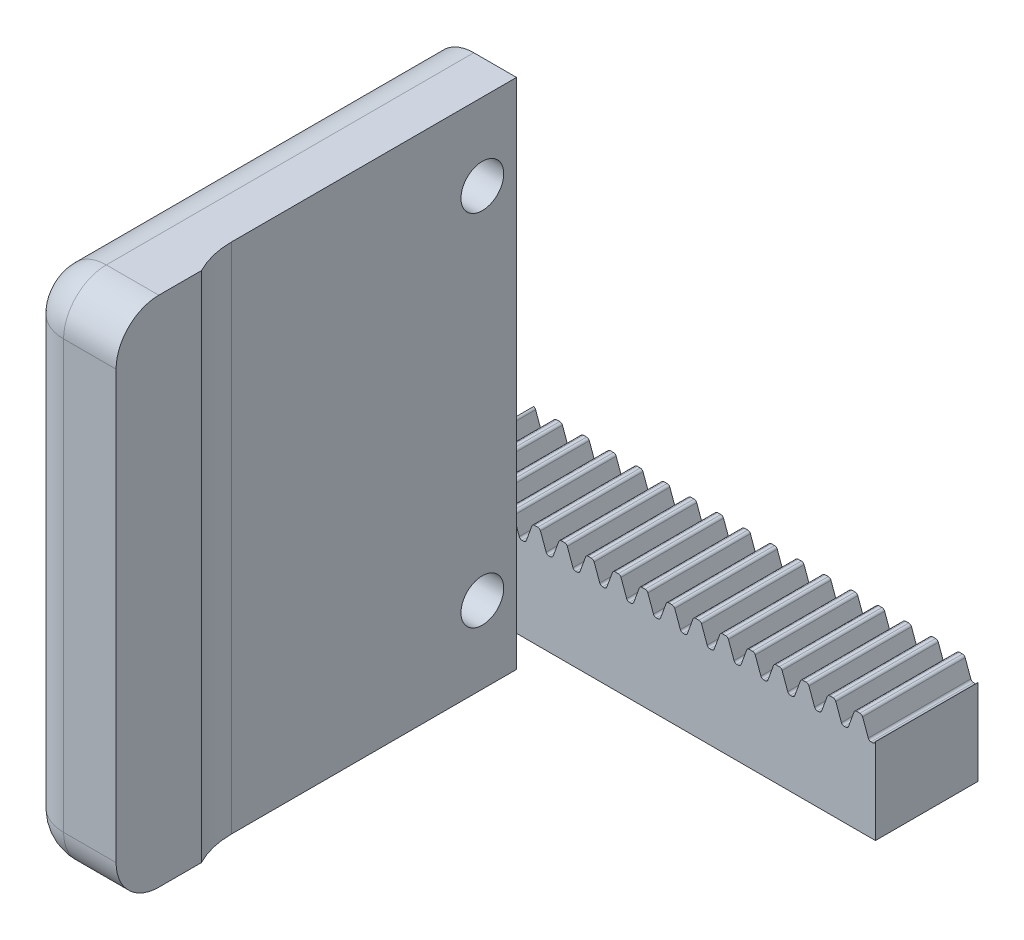
from build123d import *

# Parameters (mm, degrees)
BOSS_EXTRUDE1_DEPTH      = 6
BOSS_EXTRUDE1_DEPTH_BACK = 6
SKETCH3_W                = 100
SKETCH3_H                = 12
CUT_EXTRUDE1_DEPTH       = 51.714889332
LPATTERN1_COUNT          = 32
LPATTERN1_PITCH          = 3.141592654
LPATTERN1_COL_COUNT      = 2
LPATTERN1_COL_PITCH      = 3.141592654
SKETCH5_W                = 48.378939127
SKETCH5_H                = 12.380230967
CUT_EXTRUDE2_DEPTH       = 52.768716422
SKETCH6_W                = 10
SKETCH6_H                = 60
BOSS_EXTRUDE2_DEPTH      = 8
SKETCH8_R                = 2.5
CUT_EXTRUDE3_DEPTH       = 74.716454066
SKETCH9_W                = 11.14
SKETCH9_H                = 60
BOSS_EXTRUDE3_DEPTH      = 40
CUT_EXTRUDE4_DEPTH       = 95.952619764
CUT_EXTRUDE4_DEPTH_BACK  = 95.952619764
SKETCH10_W               = 1.14
SKETCH10_H               = 30
FILLET2_R                = 5
FILLET3_R                = 10


with BuildPart() as part:
    # Sketch3 → Boss-Extrude1 (new, two sides: drawn at the far end of the back side and taken through both)
    with BuildSketch(Plane.XY.offset(-BOSS_EXTRUDE1_DEPTH_BACK)):
        Rectangle(SKETCH3_W, SKETCH3_H)
    extrude(amount=BOSS_EXTRUDE1_DEPTH + BOSS_EXTRUDE1_DEPTH_BACK)

    # Sketch4 → Cut-Extrude1 (cut, symmetric)
    with BuildSketch(Plane.XY):
        with BuildLine():
            Line((-47.625666184, 5.779244445), (-47.545317733, 6))
            Line((-47.545317733, 6), (-48.694686131, 6))
            Line((-48.694686131, 6), (-48.694686131, 3.75))
            Line((-48.694686131, 3.75), (-48.599173915, 3.75))
            ThreePointArc((-48.599173915, 3.75), (-48.406736132, 3.8106754), (-48.283902309, 3.970755555))
            Line((-48.283902309, 3.970755555), (-47.625666184, 5.779244445))
        make_face()
        with BuildLine():
            Line((-47.310394578, 6), (-47.545317733, 6))
            Line((-47.545317733, 6), (-47.625666184, 5.779244445))
            ThreePointArc((-47.625666184, 5.779244445), (-47.502832361, 5.9393246), (-47.310394578, 6))
        make_face()
        with BuildLine():
            Line((-46.622113424, 5.779244445), (-46.702461875, 6))
            Line((-46.702461875, 6), (-46.93738503, 6))
            ThreePointArc((-46.93738503, 6), (-46.744947247, 5.9393246), (-46.622113424, 5.779244445))
        make_face()
        with BuildLine():
            Line((-45.553093477, 3.75), (-45.553093477, 6))
            Line((-45.553093477, 6), (-46.702461875, 6))
            Line((-46.702461875, 6), (-46.622113424, 5.779244445))
            Line((-46.622113424, 5.779244445), (-45.963877299, 3.970755555))
            ThreePointArc((-45.963877299, 3.970755555), (-45.841043475, 3.8106754), (-45.648605692, 3.75))
            Line((-45.648605692, 3.75), (-45.553093477, 3.75))
        make_face()
    cut_extrude1 = extrude(amount=CUT_EXTRUDE1_DEPTH, both=True, mode=Mode.SUBTRACT)

    # LPattern1: Cut-Extrude1 ×32
    with Locations(*[(i * LPATTERN1_PITCH, 0, 0) for i in range(1, LPATTERN1_COUNT)]):
        add(cut_extrude1, mode=Mode.SUBTRACT)

    # LPattern1 col: Cut-Extrude1 ×2
    with Locations(*[(-i * LPATTERN1_COL_PITCH, 0, 0) for i in range(1, LPATTERN1_COL_COUNT)]):
        add(cut_extrude1, mode=Mode.SUBTRACT)

    # Sketch5 → Cut-Extrude2 (cut, through all)
    with BuildSketch(Plane.XY.offset(6)):
        with Locations((26.189469564, 0.190115484)):
            Rectangle(SKETCH5_W, SKETCH5_H)
    extrude(amount=-CUT_EXTRUDE2_DEPTH, mode=Mode.SUBTRACT)

    # Sketch6 → Boss-Extrude2 (add)
    with BuildSketch(Plane.XY.offset(6)):
        with Locations((-45, 20.34)):
            Rectangle(SKETCH6_W, SKETCH6_H)
    extrude(amount=BOSS_EXTRUDE2_DEPTH)

    # Sketch8 → Cut-Extrude3 (cut, through all)
    with BuildSketch(Plane.ZY.offset(50)):
        with Locations((10, 41.34)):
            Circle(SKETCH8_R)
        with Locations((10, -0.66)):
            Circle(SKETCH8_R)
    extrude(amount=-CUT_EXTRUDE3_DEPTH, mode=Mode.SUBTRACT)

    # Sketch9 → Boss-Extrude3 (add)
    with BuildSketch(Plane.XY.offset(14)):
        with Locations((-44.43, 20.34)):
            Rectangle(SKETCH9_W, SKETCH9_H)
    extrude(amount=BOSS_EXTRUDE3_DEPTH)

    # Sketch10 → Cut-Extrude4 (cut, two sides: drawn at the far end of the back side and taken through both)
    with BuildSketch(Plane.XZ.offset(9.66).offset(-CUT_EXTRUDE4_DEPTH_BACK)):
        with Locations((-39.43, 29)):
            Rectangle(SKETCH10_W, SKETCH10_H)
    extrude(amount=CUT_EXTRUDE4_DEPTH + CUT_EXTRUDE4_DEPTH_BACK, mode=Mode.SUBTRACT)

    # Fillet2
    fillet2_edges = [part.edges().sort_by_distance(p)[0] for p in [
        (-44.43, 50.34, 54),
        (-44.43, -9.66, 54),
        (-50, 20.34, 54),
        (-50, 50.34, 30),
        (-50, -9.66, 30),
    ]]
    fillet(fillet2_edges, radius=FILLET2_R)

    # Fillet3
    # the kernel refuses this fillet: 10 mm, written as the material it adds along each edge
    with BuildSketch(Plane(origin=(-40, 50.34, 44), x_dir=(0, 0, -1), z_dir=(0, -1, 0))) as fillet3_piece_1:
        with BuildLine():
            CenterArc((4.636852381, 10), FILLET3_R, 242.374833946, 27.625166054)
            Line((0, 1.14), (-0.092737048, 0.9628))
            ThreePointArc((-0.092737048, 0.9628), (-0.2, 0.57), (-0.2, 0))
            Line((-0.2, 0), (0, -0.2))
            Line((0, -0.2), (4.636852381, -0.2))
            Line((4.636852381, -0.2), (4.636852381, 0))
        make_face()
    extrude(amount=60)


solid = part.part
